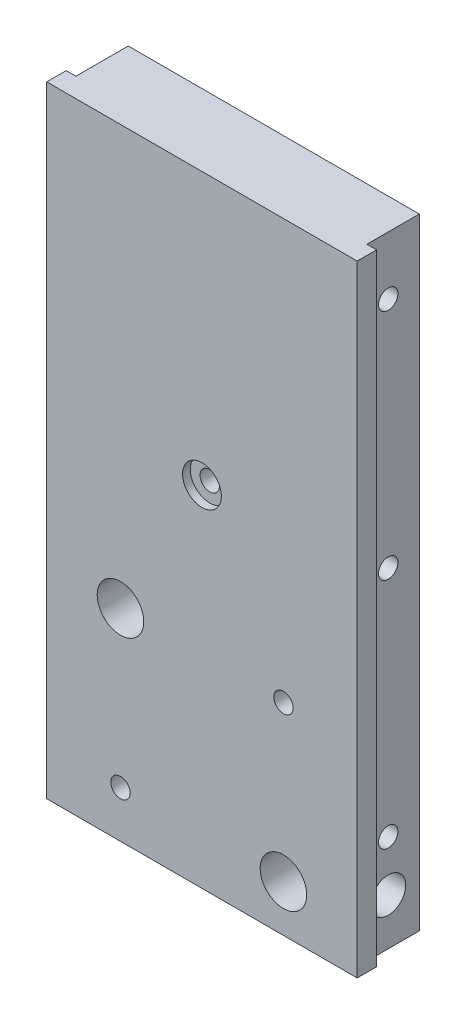
from build123d import *
from OCP.BRepAlgoAPI import BRepAlgoAPI_Cut
from OCP.TopTools import TopTools_ListOfShape

# Parameters (mm, degrees)
BOSS_EXTRUDE1_DEPTH = 160
SKETCH2_R           = 5
CUT_EXTRUDE1_DEPTH  = 2
SKETCH3_R           = 2.5
CUT_EXTRUDE2_DEPTH  = 174.084103307
SKETCH4_R           = 2.5
SKETCH4_R_2         = 6
CUT_EXTRUDE3_DEPTH  = 174.286199049
SKETCH5_R           = 2.5
CUT_EXTRUDE4_DEPTH  = 5
SKETCH6_R           = 2.5
SKETCH6_R_2         = 4.5
CUT_EXTRUDE5_DEPTH  = 15
CUT_EXTRUDE6_START  = -15
SKETCH7_R           = 2.5
SKETCH7_R_2         = 3.51695151
CUT_EXTRUDE6_DEPTH  = 15


with BuildPart() as part:
    # Sketch1 → Boss-Extrude1 (new body)
    with BuildSketch(Plane(origin=(0, 0, 0), x_dir=(1, 0, 0), z_dir=(0, 1, 0))):
        Polygon((-16.079290349, -9.231e-06), (63.920709651, -9.231e-06), (63.920709651, 4.999990769), (61.420709651, 4.999990769), (61.420709651, 18.499990769), (-13.579290349, 18.499990769), (-13.579290349, 4.999990769), (-16.079290349, 4.999990769), align=None)
    extrude(amount=BOSS_EXTRUDE1_DEPTH)


with BuildPart() as cut_extrude1_tool:
    # Sketch2 → Cut-Extrude1 (new body)
    with BuildSketch(Plane.XY):
        with Locations((23.920709651, 90)):
            Circle(SKETCH2_R)
    extrude(amount=-CUT_EXTRUDE1_DEPTH)


with BuildPart() as part_1:
    add(part.part)

    # Cut-Extrude1: cut by cut_extrude1_tool, with a tolerance
    cut_extrude1_stock = TopTools_ListOfShape()
    cut_extrude1_stock.Append(part_1.part.wrapped)
    cut_extrude1_tools = TopTools_ListOfShape()
    cut_extrude1_tools.Append(cut_extrude1_tool.part.wrapped)
    cut_extrude1_cut = BRepAlgoAPI_Cut()
    cut_extrude1_cut.SetArguments(cut_extrude1_stock)
    cut_extrude1_cut.SetTools(cut_extrude1_tools)
    cut_extrude1_cut.SetFuzzyValue(0.00001)
    cut_extrude1_cut.Build()
    add(Compound.cast(cut_extrude1_cut.Shape()).solids(), mode=Mode.REPLACE)

    # Sketch3 → Cut-Extrude2 (cut, through all)
    with BuildSketch(Plane.XY.offset(-2)):
        with Locations((23.920709651, 90)):
            Circle(SKETCH3_R)
    extrude(amount=-CUT_EXTRUDE2_DEPTH, mode=Mode.SUBTRACT)


with BuildPart() as cut_extrude3_tool:
    # Sketch4 → Cut-Extrude3 (new, through all)
    with BuildSketch(Plane.XY):
        with Locations((2.920709651, 12)):
            Circle(SKETCH4_R)
        with Locations((44.920709651, 12)):
            Circle(SKETCH4_R_2)
        with Locations((2.920709651, 52)):
            Circle(SKETCH4_R_2)
        with Locations((44.920709651, 52)):
            Circle(SKETCH4_R)
    extrude(amount=-CUT_EXTRUDE3_DEPTH)


with BuildPart() as part_2:
    add(part_1.part)

    # Cut-Extrude3: cut by cut_extrude3_tool, with a tolerance
    cut_extrude3_stock = TopTools_ListOfShape()
    cut_extrude3_stock.Append(part_2.part.wrapped)
    cut_extrude3_tools = TopTools_ListOfShape()
    cut_extrude3_tools.Append(cut_extrude3_tool.part.wrapped)
    cut_extrude3_cut = BRepAlgoAPI_Cut()
    cut_extrude3_cut.SetArguments(cut_extrude3_stock)
    cut_extrude3_cut.SetTools(cut_extrude3_tools)
    cut_extrude3_cut.SetFuzzyValue(0.00001)
    cut_extrude3_cut.Build()
    add(Compound.cast(cut_extrude3_cut.Shape()).solids(), mode=Mode.REPLACE)

    # Sketch5 → Cut-Extrude4 (cut)
    with BuildSketch(Plane.XZ):
        with Locations((57.920709651, -11.71640591)):
            Circle(SKETCH5_R)
        with Locations((-10.079290349, -11.71640591)):
            Circle(SKETCH5_R)
    extrude(amount=-CUT_EXTRUDE4_DEPTH, mode=Mode.SUBTRACT)

    # Sketch6 → Cut-Extrude5 (cut)
    with BuildSketch(Plane(origin=(61.420709651, 0, 0), x_dir=(0, 0, -1), z_dir=(1, 0, 0))):
        with Locations((10.499990769, 145)):
            Circle(SKETCH6_R)
        with Locations((10.499990769, 85)):
            Circle(SKETCH6_R)
        with Locations((10.499990769, 25)):
            Circle(SKETCH6_R)
        with Locations((10.499990769, 12)):
            Circle(SKETCH6_R_2)
    extrude(amount=-CUT_EXTRUDE5_DEPTH, mode=Mode.SUBTRACT)

    # Sketch7 → Cut-Extrude6 (cut)
    with BuildSketch(Plane.ZY.offset(13.579290349).offset(CUT_EXTRUDE6_START)):
        with Locations((-10.499990769, 145)):
            Circle(SKETCH7_R)
        with Locations((-10.499990769, 85)):
            Circle(SKETCH7_R)
        with Locations((-10.499990769, 25)):
            Circle(SKETCH7_R)
        with Locations((-10.499990769, 52)):
            Circle(SKETCH7_R_2)
    extrude(amount=CUT_EXTRUDE6_DEPTH, mode=Mode.SUBTRACT)


solid = part_2.part
